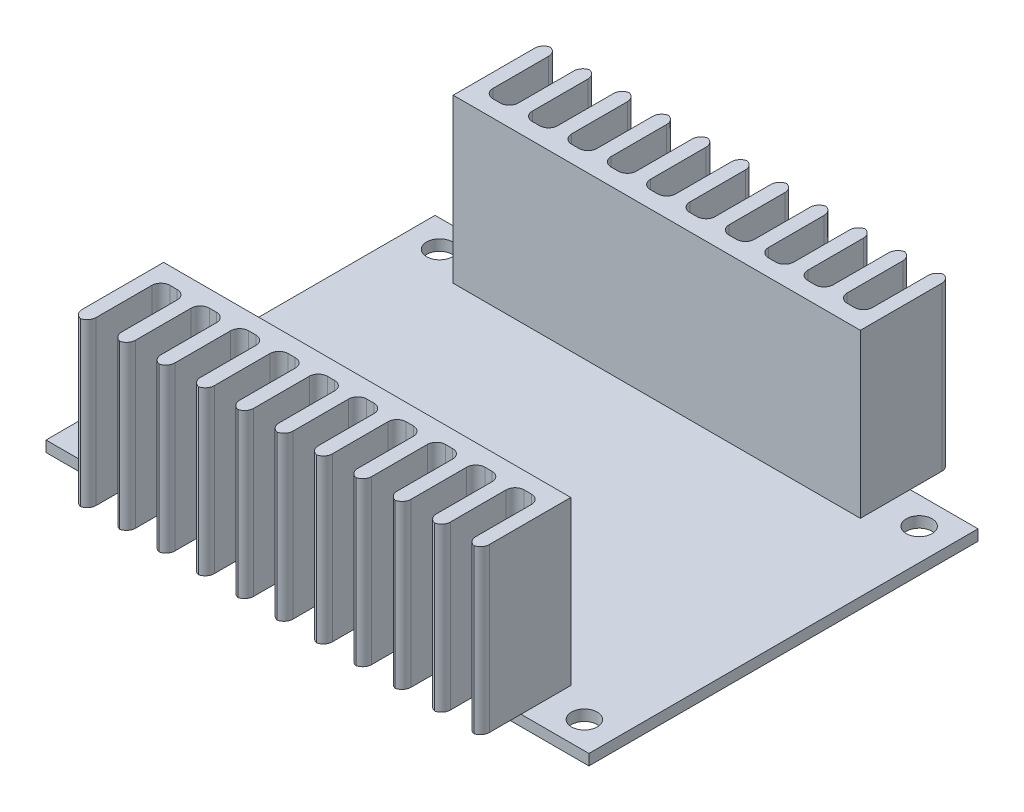
from build123d import *

# Parameters (mm, degrees)
ESQUISSE1_W             = 60
ESQUISSE1_H             = 43
BOSS_EXTRU_1_DEPTH      = 1.2
ESQUISSE2_W             = 45
ESQUISSE2_H             = 10
BOSS_EXTRU_2_DEPTH      = 18
ESQUISSE3_W             = 2.8
ESQUISSE3_H             = 8.15
ENL_V_MAT_EXTRU_1_DEPTH = 18
CONG_2_R                = 1
CONG_2_OF_SYM_TRIE1_R   = 1
ESQUISSE4_R             = 1.425
ENL_V_MAT_EXTRU_2_DEPTH = 44.573699788


with BuildPart() as part:
    # Esquisse1 → Boss.-Extru.1 (new body)
    with BuildSketch(Plane(origin=(0, 0, 0), x_dir=(1, 0, 0), z_dir=(0, 1, 0))):
        Rectangle(ESQUISSE1_W, ESQUISSE1_H)
    extrude(amount=BOSS_EXTRU_1_DEPTH)

    # Esquisse2 → Boss.-Extru.2 (add)
    with BuildSketch(Plane(origin=(0, 1.2, 0), x_dir=(1, 0, 0), z_dir=(0, 1, 0))):
        with Locations((0, -21)):
            Rectangle(ESQUISSE2_W, ESQUISSE2_H)
    boss_extru_2 = extrude(amount=BOSS_EXTRU_2_DEPTH)

    # Esquisse3 → Enlèv. mat.-Extru.1 (cut)
    with BuildSketch(Plane(origin=(0, 19.2, 0), x_dir=(1, 0, 0), z_dir=(0, 1, 0))):
        with Locations((-19.554545455, -21.925)):
            Rectangle(ESQUISSE3_W, ESQUISSE3_H)
        with Locations((-15.204545455, -21.925)):
            Rectangle(ESQUISSE3_W, ESQUISSE3_H)
        with Locations((-10.854545455, -21.925)):
            Rectangle(ESQUISSE3_W, ESQUISSE3_H)
        with Locations((-6.504545455, -21.925)):
            Rectangle(ESQUISSE3_W, ESQUISSE3_H)
        with Locations((-2.154545455, -21.925)):
            Rectangle(ESQUISSE3_W, ESQUISSE3_H)
        with Locations((2.195454545, -21.925)):
            Rectangle(ESQUISSE3_W, ESQUISSE3_H)
        with Locations((6.545454545, -21.925)):
            Rectangle(ESQUISSE3_W, ESQUISSE3_H)
        with Locations((10.895454545, -21.925)):
            Rectangle(ESQUISSE3_W, ESQUISSE3_H)
        with Locations((15.245454545, -21.925)):
            Rectangle(ESQUISSE3_W, ESQUISSE3_H)
        with Locations((19.595454545, -21.925)):
            Rectangle(ESQUISSE3_W, ESQUISSE3_H)
    enl_v_mat_extru_1 = extrude(amount=-ENL_V_MAT_EXTRU_1_DEPTH, mode=Mode.SUBTRACT)

    # Congé2
    # the kernel refuses this fillet: 1 mm, written as the material it adds along each edge
    with BuildSketch(Plane(origin=(18.195454545, 19.2, 17.85), x_dir=(0, 0, 1), z_dir=(0, -1, 0)), Plane(origin=(13.845454545, 19.2, 17.85), x_dir=(0, 0, 1), z_dir=(0, -1, 0)), Plane(origin=(9.495454545, 19.2, 17.85), x_dir=(0, 0, 1), z_dir=(0, -1, 0)), Plane(origin=(5.145454545, 19.2, 17.85), x_dir=(0, 0, 1), z_dir=(0, -1, 0)), Plane(origin=(0.795454545, 19.2, 17.85), x_dir=(0, 0, 1), z_dir=(0, -1, 0)), Plane(origin=(-3.554545455, 19.2, 17.85), x_dir=(0, 0, 1), z_dir=(0, -1, 0)), Plane(origin=(-7.904545455, 19.2, 17.85), x_dir=(0, 0, 1), z_dir=(0, -1, 0)), Plane(origin=(-12.254545455, 19.2, 17.85), x_dir=(0, 0, 1), z_dir=(0, -1, 0)), Plane(origin=(-16.604545455, 19.2, 17.85), x_dir=(0, 0, 1), z_dir=(0, -1, 0)), Plane(origin=(-20.954545455, 19.2, 17.85), x_dir=(0, 0, 1), z_dir=(0, -1, 0))) as cong_2_piece_1:
        with BuildLine():
            CenterArc((CONG_2_R, -CONG_2_R), CONG_2_R, 90, 90)
            Line((0, -CONG_2_R), (0, 0))
            Line((0, 0), (CONG_2_R, 0))
        make_face()
    extrude(amount=18)
    with BuildSketch(Plane(origin=(-5.104545455, 19.2, 17.85), x_dir=(0, 0, 1), z_dir=(0, -1, 0)), Plane(origin=(-0.754545455, 19.2, 17.85), x_dir=(0, 0, 1), z_dir=(0, -1, 0)), Plane(origin=(3.595454545, 19.2, 17.85), x_dir=(0, 0, 1), z_dir=(0, -1, 0)), Plane(origin=(7.945454545, 19.2, 17.85), x_dir=(0, 0, 1), z_dir=(0, -1, 0)), Plane(origin=(12.295454545, 19.2, 17.85), x_dir=(0, 0, 1), z_dir=(0, -1, 0)), Plane(origin=(16.645454545, 19.2, 17.85), x_dir=(0, 0, 1), z_dir=(0, -1, 0)), Plane(origin=(20.995454545, 19.2, 17.85), x_dir=(0, 0, 1), z_dir=(0, -1, 0)), Plane(origin=(-9.454545455, 19.2, 17.85), x_dir=(0, 0, 1), z_dir=(0, -1, 0)), Plane(origin=(-13.804545455, 19.2, 17.85), x_dir=(0, 0, 1), z_dir=(0, -1, 0)), Plane(origin=(-18.154545455, 19.2, 17.85), x_dir=(0, 0, 1), z_dir=(0, -1, 0))) as cong_2_piece_2:
        with BuildLine():
            CenterArc((CONG_2_R, CONG_2_R), CONG_2_R, 180, 90)
            Line((0, CONG_2_R), (0, 0))
            Line((0, 0), (CONG_2_R, 0))
        make_face()
    extrude(amount=18)
    # the kernel refuses this fillet: 1 mm, written as the material it takes off along each edge
    with BuildSketch(Plane(origin=(22.5, -1.3, 26), x_dir=(0, 0, -1), z_dir=(0, 1, 0)), Plane(origin=(-20.954545455, 21.7, 26), x_dir=(-1, 0, 0), z_dir=(0, -1, 0))) as cong_2_2_piece_1:
        with BuildLine():
            CenterArc((CONG_2_R, CONG_2_R), CONG_2_R, 180, 90)
            Line((0, CONG_2_R), (0, 0))
            Line((0, 0), (CONG_2_R, 0))
        make_face()
    extrude(amount=23, mode=Mode.SUBTRACT)
    with BuildSketch(Plane(origin=(20.995454545, 21.7, 26), x_dir=(1, 0, 0), z_dir=(0, -1, 0)), Plane(origin=(18.195454545, 21.7, 26), x_dir=(0, 0, -1), z_dir=(0, -1, 0)), Plane(origin=(16.645454545, 21.7, 26), x_dir=(1, 0, 0), z_dir=(0, -1, 0)), Plane(origin=(13.845454545, 21.7, 26), x_dir=(0, 0, -1), z_dir=(0, -1, 0)), Plane(origin=(12.295454545, 21.7, 26), x_dir=(1, 0, 0), z_dir=(0, -1, 0)), Plane(origin=(9.495454545, 21.7, 26), x_dir=(0, 0, -1), z_dir=(0, -1, 0)), Plane(origin=(7.945454545, 21.7, 26), x_dir=(1, 0, 0), z_dir=(0, -1, 0)), Plane(origin=(5.145454545, 21.7, 26), x_dir=(0, 0, -1), z_dir=(0, -1, 0)), Plane(origin=(3.595454545, 21.7, 26), x_dir=(1, 0, 0), z_dir=(0, -1, 0)), Plane(origin=(0.795454545, 21.7, 26), x_dir=(0, 0, -1), z_dir=(0, -1, 0)), Plane(origin=(-0.754545455, 21.7, 26), x_dir=(1, 0, 0), z_dir=(0, -1, 0)), Plane(origin=(-3.554545455, 21.7, 26), x_dir=(0, 0, -1), z_dir=(0, -1, 0)), Plane(origin=(-5.104545455, 21.7, 26), x_dir=(1, 0, 0), z_dir=(0, -1, 0)), Plane(origin=(-7.904545455, 21.7, 26), x_dir=(0, 0, -1), z_dir=(0, -1, 0)), Plane(origin=(-9.454545455, 21.7, 26), x_dir=(1, 0, 0), z_dir=(0, -1, 0)), Plane(origin=(-12.254545455, 21.7, 26), x_dir=(0, 0, -1), z_dir=(0, -1, 0)), Plane(origin=(-13.804545455, 21.7, 26), x_dir=(1, 0, 0), z_dir=(0, -1, 0)), Plane(origin=(-16.604545455, 21.7, 26), x_dir=(0, 0, -1), z_dir=(0, -1, 0)), Plane(origin=(-18.154545455, 21.7, 26), x_dir=(1, 0, 0), z_dir=(0, -1, 0)), Plane(origin=(-22.5, -1.3, 26), x_dir=(0, 0, -1), z_dir=(0, 1, 0))) as cong_2_2_piece_2:
        with BuildLine():
            CenterArc((CONG_2_R, -CONG_2_R), CONG_2_R, 90, 90)
            Line((0, -CONG_2_R), (0, 0))
            Line((0, 0), (CONG_2_R, 0))
        make_face()
    extrude(amount=23, mode=Mode.SUBTRACT)

    # Symétrie1: Boss.-Extru.2, Enlèv. mat.-Extru.1 across plane
    add(boss_extru_2.mirror(Plane.XY))
    add(enl_v_mat_extru_1.mirror(Plane.XY), mode=Mode.SUBTRACT)

    # Congé2 of Symétrie1
    # the kernel refuses this fillet: 1 mm, written as the material it adds along each edge
    with BuildSketch(Plane(origin=(18.195454545, 19.2, -17.85), x_dir=(0, 0, -1), z_dir=(0, -1, 0)), Plane(origin=(13.845454545, 19.2, -17.85), x_dir=(0, 0, -1), z_dir=(0, -1, 0)), Plane(origin=(9.495454545, 19.2, -17.85), x_dir=(0, 0, -1), z_dir=(0, -1, 0)), Plane(origin=(5.145454545, 19.2, -17.85), x_dir=(0, 0, -1), z_dir=(0, -1, 0)), Plane(origin=(0.795454545, 19.2, -17.85), x_dir=(0, 0, -1), z_dir=(0, -1, 0)), Plane(origin=(-3.554545455, 19.2, -17.85), x_dir=(0, 0, -1), z_dir=(0, -1, 0)), Plane(origin=(-7.904545455, 19.2, -17.85), x_dir=(0, 0, -1), z_dir=(0, -1, 0)), Plane(origin=(-5.104545455, 19.2, -17.85), x_dir=(-1, 0, 0), z_dir=(0, -1, 0)), Plane(origin=(-0.754545455, 19.2, -17.85), x_dir=(-1, 0, 0), z_dir=(0, -1, 0)), Plane(origin=(3.595454545, 19.2, -17.85), x_dir=(-1, 0, 0), z_dir=(0, -1, 0)), Plane(origin=(7.945454545, 19.2, -17.85), x_dir=(-1, 0, 0), z_dir=(0, -1, 0)), Plane(origin=(12.295454545, 19.2, -17.85), x_dir=(-1, 0, 0), z_dir=(0, -1, 0)), Plane(origin=(16.645454545, 19.2, -17.85), x_dir=(-1, 0, 0), z_dir=(0, -1, 0)), Plane(origin=(20.995454545, 19.2, -17.85), x_dir=(-1, 0, 0), z_dir=(0, -1, 0)), Plane(origin=(-9.454545455, 19.2, -17.85), x_dir=(-1, 0, 0), z_dir=(0, -1, 0)), Plane(origin=(-12.254545455, 19.2, -17.85), x_dir=(0, 0, -1), z_dir=(0, -1, 0)), Plane(origin=(-13.804545455, 19.2, -17.85), x_dir=(-1, 0, 0), z_dir=(0, -1, 0)), Plane(origin=(-16.604545455, 19.2, -17.85), x_dir=(0, 0, -1), z_dir=(0, -1, 0)), Plane(origin=(-18.154545455, 19.2, -17.85), x_dir=(-1, 0, 0), z_dir=(0, -1, 0)), Plane(origin=(-20.954545455, 19.2, -17.85), x_dir=(0, 0, -1), z_dir=(0, -1, 0))) as cong_2_of_sym_trie1_piece_1:
        with BuildLine():
            CenterArc((CONG_2_OF_SYM_TRIE1_R, CONG_2_OF_SYM_TRIE1_R), CONG_2_OF_SYM_TRIE1_R, 180, 90)
            Line((0, CONG_2_OF_SYM_TRIE1_R), (0, 0))
            Line((0, 0), (CONG_2_OF_SYM_TRIE1_R, 0))
        make_face()
    extrude(amount=18)
    # the kernel refuses this fillet: 1 mm, written as the material it takes off along each edge
    with BuildSketch(Plane(origin=(22.5, -1.3, -26), x_dir=(0, 0, 1), z_dir=(0, 1, 0)), Plane(origin=(18.195454545, 21.7, -26), x_dir=(-1, 0, 0), z_dir=(0, -1, 0)), Plane(origin=(16.645454545, 21.7, -26), x_dir=(0, 0, 1), z_dir=(0, -1, 0)), Plane(origin=(13.845454545, 21.7, -26), x_dir=(-1, 0, 0), z_dir=(0, -1, 0)), Plane(origin=(12.295454545, 21.7, -26), x_dir=(0, 0, 1), z_dir=(0, -1, 0)), Plane(origin=(9.495454545, 21.7, -26), x_dir=(-1, 0, 0), z_dir=(0, -1, 0)), Plane(origin=(7.945454545, 21.7, -26), x_dir=(0, 0, 1), z_dir=(0, -1, 0)), Plane(origin=(5.145454545, 21.7, -26), x_dir=(-1, 0, 0), z_dir=(0, -1, 0)), Plane(origin=(3.595454545, 21.7, -26), x_dir=(0, 0, 1), z_dir=(0, -1, 0)), Plane(origin=(0.795454545, 21.7, -26), x_dir=(-1, 0, 0), z_dir=(0, -1, 0)), Plane(origin=(-0.754545455, 21.7, -26), x_dir=(0, 0, 1), z_dir=(0, -1, 0)), Plane(origin=(-3.554545455, 21.7, -26), x_dir=(-1, 0, 0), z_dir=(0, -1, 0)), Plane(origin=(-5.104545455, 21.7, -26), x_dir=(0, 0, 1), z_dir=(0, -1, 0)), Plane(origin=(-7.904545455, 21.7, -26), x_dir=(-1, 0, 0), z_dir=(0, -1, 0)), Plane(origin=(-9.454545455, 21.7, -26), x_dir=(0, 0, 1), z_dir=(0, -1, 0)), Plane(origin=(-12.254545455, 21.7, -26), x_dir=(-1, 0, 0), z_dir=(0, -1, 0)), Plane(origin=(-13.804545455, 21.7, -26), x_dir=(0, 0, 1), z_dir=(0, -1, 0)), Plane(origin=(-16.604545455, 21.7, -26), x_dir=(-1, 0, 0), z_dir=(0, -1, 0)), Plane(origin=(-18.154545455, 21.7, -26), x_dir=(0, 0, 1), z_dir=(0, -1, 0)), Plane(origin=(-20.954545455, 21.7, -26), x_dir=(-1, 0, 0), z_dir=(0, -1, 0))) as cong_2_of_sym_trie1_2_piece_1:
        with BuildLine():
            CenterArc((CONG_2_OF_SYM_TRIE1_R, -CONG_2_OF_SYM_TRIE1_R), CONG_2_OF_SYM_TRIE1_R, 90, 90)
            Line((0, -CONG_2_OF_SYM_TRIE1_R), (0, 0))
            Line((0, 0), (CONG_2_OF_SYM_TRIE1_R, 0))
        make_face()
    extrude(amount=23, mode=Mode.SUBTRACT)
    with BuildSketch(Plane(origin=(20.995454545, 21.7, -26), x_dir=(1, 0, 0), z_dir=(0, -1, 0)), Plane(origin=(-22.5, -1.3, -26), x_dir=(0, 0, 1), z_dir=(0, 1, 0))) as cong_2_of_sym_trie1_2_piece_2:
        with BuildLine():
            CenterArc((CONG_2_OF_SYM_TRIE1_R, CONG_2_OF_SYM_TRIE1_R), CONG_2_OF_SYM_TRIE1_R, 180, 90)
            Line((0, CONG_2_OF_SYM_TRIE1_R), (0, 0))
            Line((0, 0), (CONG_2_OF_SYM_TRIE1_R, 0))
        make_face()
    extrude(amount=23, mode=Mode.SUBTRACT)

    # Esquisse4 → Enlèv. mat.-Extru.2 (cut, through all)
    with BuildSketch(Plane(origin=(0, 1.2, 0), x_dir=(1, 0, 0), z_dir=(0, 1, 0))):
        with Locations(Location((-26.5, -18.5, 0), (0, 0, 270))):
            Circle(ESQUISSE4_R)
        with Locations(Location((-26.5, 18.5, 0), (0, 0, 270))):
            Circle(ESQUISSE4_R)
        with Locations(Location((26.5, 18.5, 0), (0, 0, 270))):
            Circle(ESQUISSE4_R)
        with Locations(Location((26.5, -18.5, 0), (0, 0, 270))):
            Circle(ESQUISSE4_R)
    extrude(amount=-ENL_V_MAT_EXTRU_2_DEPTH, mode=Mode.SUBTRACT)


solid = part.part
